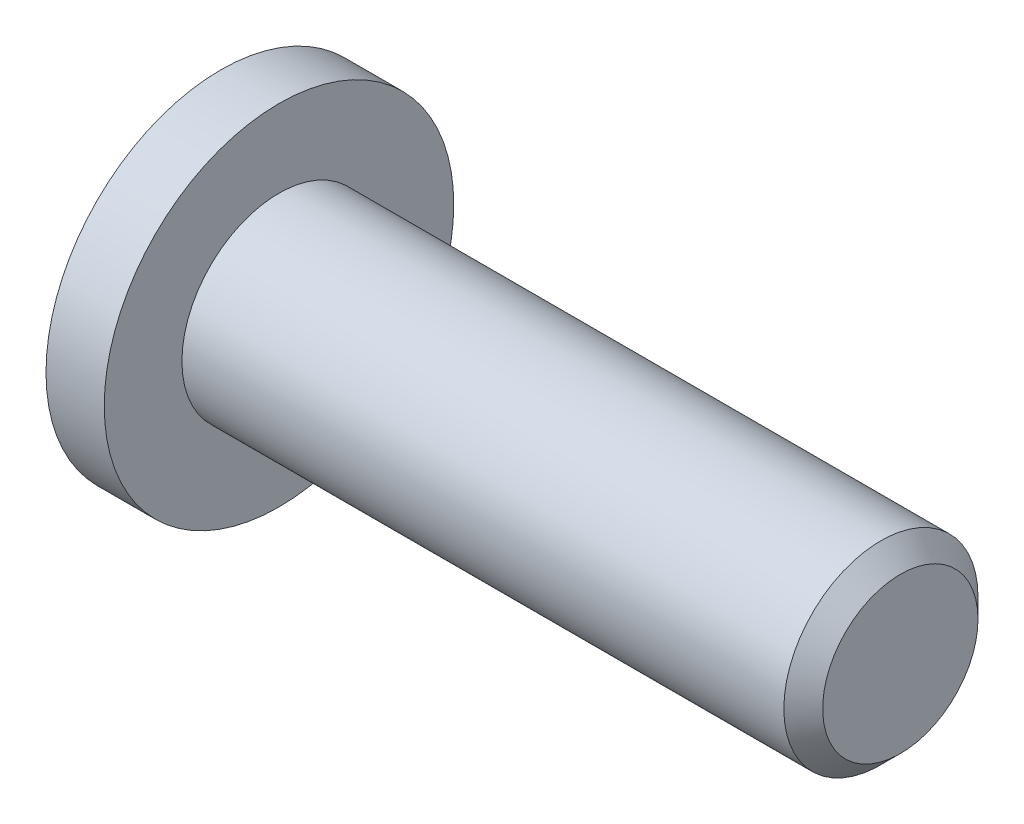
from build123d import *

# Parameters (mm, degrees)
SKETCH1_R     = 4.5
HEAD_DEPTH    = 1.5
SKETCH2_R     = 2.5
BODY_DEPTH    = 16
DRIVE_DEPTH   = 3
CHAMFER1_SIZE = 0.5


with BuildPart() as part:
    # Sketch1 → Head (new body)
    with BuildSketch(Plane(origin=(0, 0, 0), x_dir=(0, 0, -1), z_dir=(1, 0, 0))):
        Circle(SKETCH1_R)
    extrude(amount=HEAD_DEPTH)

    # Sketch2 → Body (add)
    with BuildSketch(Plane(origin=(1.5, 0, 0), x_dir=(0, 0, -1), z_dir=(1, 0, 0))):
        Circle(SKETCH2_R)
    extrude(amount=BODY_DEPTH)

    # Sketch3 → Drive (cut)
    with BuildSketch(Plane.ZY):
        Polygon((0, 1.732050808), (-1.5, 0.866025404), (-1.5, -0.866025404), (0, -1.732050808), (1.5, -0.866025404), (1.5, 0.866025404), align=None)
    extrude(amount=-DRIVE_DEPTH, mode=Mode.SUBTRACT)

    # Chamfer1
    chamfer1_edges = [part.edges().sort_by_distance(p)[0] for p in [
        (17.5, 0, 2.5),
    ]]
    chamfer(chamfer1_edges, length=CHAMFER1_SIZE)


solid = part.part
